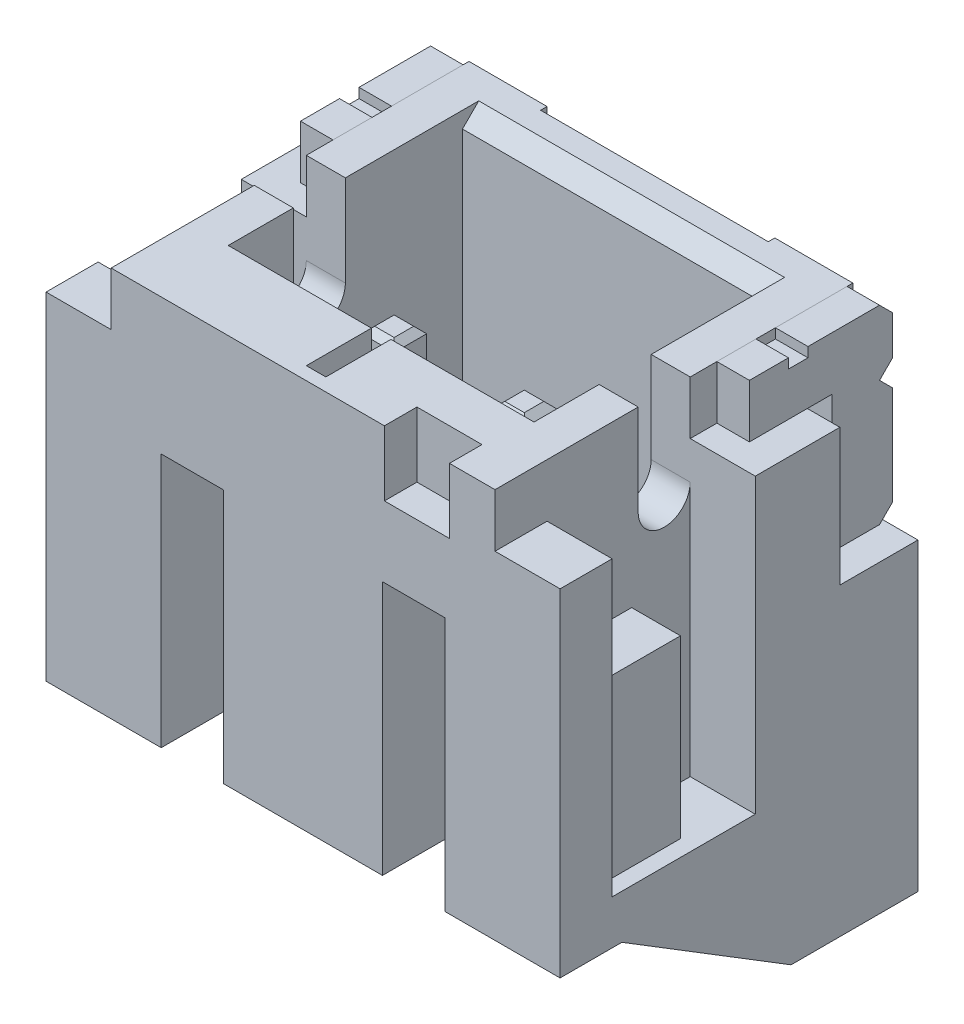
from build123d import *
from OCP.BRepFilletAPI import BRepFilletAPI_MakeChamfer

# Parameters (mm, degrees)
BODY1_W                               = 5.9
BODY1_H                               = 5.5
EXTRUDE_1_DEPTH                       = 6
SKETCH_2_W                            = 4.7
SKETCH_2_H                            = 3.6
CUT_EXTRUDE_1_DEPTH                   = 4.2
SKETCH_5_W                            = 0.7
SKETCH_5_H                            = 4.15
CUT_EXTRUDE_4_DEPTH                   = 0.4
SKETCH_8_W                            = 0.3
SKETCH_8_H                            = 4.2
CUT_EXTRUDE_6_DEPTH                   = 0.75
CUT_EXTRUDE_7_REACH                   = 12.053
SKETCH_10_W                           = 0.5
SKETCH_10_H                           = 1.6
EXTRUDE_2_DEPTH                       = 0.3
CHAMFER_2_SIZE                        = 0.25
SKETCH_18_W                           = 3.5
SKETCH_18_H                           = 6
CUT_EXTRUDE_8_DEPTH                   = 0.1
EXTRUDE_6_DEPTH                       = 1
SKETCH_20_W                           = 1.3
SKETCH_20_H                           = 2.7
EXTRUDE_7_DEPTH                       = 0.75
EXTRUDE_8_DEPTH                       = 0.5
CHAMFER_9_SIZE                        = 0.25
SWEEP_START                           = 1.7
SWEEP_1_DEPTH                         = 0.5
CHAMFER_8_SIZE                        = 0.1
SKETCH_22_W                           = 1.6
SKETCH_22_H                           = 3.25
EXTRUDE_9_DEPTH                       = 0.2
CHAMFER_10_SIZE                       = 0.072794047
CHAMFER_10_SIZE_2                     = 0.2
CHAMFER_11_SIZE2                      = 0.2
CHAMFER_11_SIZE                       = 0.549495484
PATTERN_LINEAR_5_COUNT                = 2
PATTERN_LINEAR_5_PITCH                = 2
CHAMFER_8_OF_PATTERN_LINEAR_5_SIZE    = 0.1
CHAMFER_10_OF_PATTERN_LINEAR_5_SIZE   = 0.072794047
CHAMFER_10_OF_PATTERN_LINEAR_5_SIZE_2 = 0.2
CHAMFER_11_OF_PATTERN_LINEAR_5_SIZE2  = 0.2
CHAMFER_11_OF_PATTERN_LINEAR_5_SIZE   = 0.549495484
SKETCH_4_W                            = 0.96
SKETCH_4_H                            = 3.91
CUT_EXTRUDE_3_DEPTH                   = 1.2
SKETCH_23_W                           = 1
SKETCH_23_H                           = 0.5
CUT_EXTRUDE_9_DEPTH                   = 1
SKETCH_24_R                           = 0.05
CUT_EXTRUDE_10_DEPTH                  = 0.1


# Read off the part's stored shape, not the designer's step: По траектории1
with BuildPart() as part:
    # Body1 → Бобышка-Вытянуть1 (new body)
    with BuildSketch(Plane(origin=(0, 0, 0), x_dir=(1, 0, 0), z_dir=(0, 1, 0))):
        with Locations((2.95, -2.75)):
            Rectangle(BODY1_W, BODY1_H)
    extrude(amount=EXTRUDE_1_DEPTH)

    # Эскиз2 → Вырез-Вытянуть1 (cut)
    with BuildSketch(Plane(origin=(0, 6, 0), x_dir=(1, 0, 0), z_dir=(0, 1, 0))):
        with Locations((2.95, -2.5)):
            Rectangle(SKETCH_2_W, SKETCH_2_H)
    extrude(amount=-CUT_EXTRUDE_1_DEPTH, mode=Mode.SUBTRACT)

    # Эскиз5 → Вырез-Вытянуть4 (cut)
    with BuildSketch(Plane(origin=(0, 0, 4.8), x_dir=(1, 0, 0), z_dir=(0, 1, 0))):
        with Locations((1.95, 2.725)):
            Rectangle(SKETCH_5_W, SKETCH_5_H)
    cut_extrude_4 = extrude(amount=CUT_EXTRUDE_4_DEPTH, mode=Mode.SUBTRACT)

    # Эскиз8 → Вырез-Вытянуть6 (cut)
    with BuildSketch(Plane.XY.offset(4.3)):
        with Locations((2.95, 3.9)):
            Rectangle(SKETCH_8_W, SKETCH_8_H)
    extrude(amount=CUT_EXTRUDE_6_DEPTH, mode=Mode.SUBTRACT)

    # Эскиз9 → Вырез-Вытянуть7 (cut, up to next)
    with BuildSketch(Plane.ZY, mode=Mode.PRIVATE) as cut_extrude_7_sk1:
        with BuildLine():
            Line((2.5, 6), (3.3, 6))
            Line((3.3, 6), (3.3, 4.6))
            ThreePointArc((3.3, 4.6), (2.9, 4.2), (2.5, 4.6))
            Line((2.5, 4.6), (2.5, 6))
        make_face()
    cut_extrude_7_tool1 = extrude(cut_extrude_7_sk1.sketch, amount=-CUT_EXTRUDE_7_REACH, mode=Mode.PRIVATE) & part.part
    cut_extrude_7 = cut_extrude_7_tool1.solids().sort_by_distance((0, 5.140595, 2.9))[0]
    add(cut_extrude_7, mode=Mode.SUBTRACT)

    # Зеркальное отражение1: Вырез-Вытянуть7 across plane
    add(cut_extrude_7.mirror(Plane(origin=(2.95, 0, 0), x_dir=(0, 0, 1), z_dir=(1, 0, 0))), mode=Mode.SUBTRACT)

    # Эскиз10 → Бобышка-Вытянуть2 (add)
    with BuildSketch(Plane.XY.offset(0.7)):
        with Locations((2.95, 2.6)):
            Rectangle(SKETCH_10_W, SKETCH_10_H)
    extrude(amount=EXTRUDE_2_DEPTH)

    # Фаска2
    chamfer_2_edges = [part.edges().sort_by_distance(p)[0] for p in [
        (2.95, 3.4, 1),
    ]]
    chamfer(chamfer_2_edges, length=CHAMFER_2_SIZE)

    # Эскиз18 → Вырез-Вытянуть8 (cut)
    with BuildSketch(Plane(origin=(0, 0, 0), x_dir=(-1, 0, 0), z_dir=(0, 0, -1))):
        with Locations((-2.95, 3)):
            Rectangle(SKETCH_18_W, SKETCH_18_H)
    extrude(amount=-CUT_EXTRUDE_8_DEPTH, mode=Mode.SUBTRACT)

    # Эскиз19 → Бобышка-Вытянуть6 (add)
    with BuildSketch(Plane.ZY):
        Polygon((5.5, 5.18), (4.7, 5.18), (4.7, 0.68), (2.5, 0.68), (2.5, 5.18), (1.2, 5.18), (1.2, 3.08), (0, 3.08), (0, 0), (0, -1.6), (1.95, -1.6), (4.55, 0), (5.5, 0), align=None)
    extrude_6 = extrude(amount=EXTRUDE_6_DEPTH)

    # Эскиз20 → Бобышка-Вытянуть7 (add)
    with BuildSketch(Plane.ZY):
        with Locations((4.05, 2.03)):
            Rectangle(SKETCH_20_W, SKETCH_20_H)
    extrude_7 = extrude(amount=EXTRUDE_7_DEPTH)

    # Зеркальное отражение4: Бобышка-Вытянуть6, Бобышка-Вытянуть7 across plane
    add(extrude_6.mirror(Plane(origin=(2.95, 0, 0), x_dir=(0, 0, 1), z_dir=(1, 0, 0))))
    add(extrude_7.mirror(Plane(origin=(2.95, 0, 0), x_dir=(0, 0, 1), z_dir=(1, 0, 0))))

    # Фаска9
    chamfer_9_edges = [part.edges().sort_by_distance(p)[0] for p in [
        (2.95, 6, 0.7),
        (2.95, 6, 5.05),
    ]]
    chamfer(chamfer_9_edges, length=CHAMFER_9_SIZE)

    # По траектории1 outline → По траектории1 (add)
    with BuildSketch(Plane.YZ.offset(SWEEP_START)):
        with BuildLine():
            add(Edge.make_bspline(
                [(1.8, 3.35), (2.1, 3.35), (2.4, 3.35), (3.466666667, 3.35), (4.233333333, 3.35), (5, 3.35)],
                knots=[0.550626024, 0.550626024, 0.550626024, 0.550626024, 0.677012455, 0.677012455, 1, 1, 1, 1], degree=3))
            Line((1.8, 3.35), (1.8, 2.85))
            add(Edge.make_bspline(
                [(1.8, 2.85), (2.1, 2.85), (2.4, 2.85), (3.466666667, 2.85), (4.233333333, 2.85), (5, 2.85)],
                knots=[0.550626024, 0.550626024, 0.550626024, 0.550626024, 0.677012455, 0.677012455, 1, 1, 1, 1], degree=3))
            Line((5, 2.85), (5, 3.35))
        make_face()
        with BuildLine():
            Line((-1.6662e-05, 0.942155021), (0, 2.45))
            add(Edge.make_bspline(
                [(0, 2.45), (0, 2.553716576), (0.042196888, 2.657882313), (0.154637487, 2.770322912), (0.199605417, 2.800099176), (0.296209882, 2.839814108), (0.331279974, 2.849979865), (0.4, 2.85)],
                knots=[0.210644051, 0.210644051, 0.210644051, 0.210644051, 0.28233448, 0.28233448, 0.318179695, 0.318179695, 0.354024909, 0.354024909, 0.354024909, 0.354024909], degree=3))
            Line((0.4, 2.85), (0.4, 3.35))
            add(Edge.make_bspline(
                [(-0.5, 2.45), (-0.5, 2.683362296), (-0.405057001, 2.917735205), (-0.152065654, 3.170726552), (-0.050887811, 3.237723146), (0.166472235, 3.327081743), (0.298557942, 3.349954697), (0.4, 3.35)],
                knots=[0.210644051, 0.210644051, 0.210644051, 0.210644051, 0.28233448, 0.28233448, 0.318179695, 0.318179695, 0.354024909, 0.354024909, 0.354024909, 0.354024909], degree=3))
            Line((-0.5, 2.45), (-0.500062578, 0.957586603))
            ThreePointArc((-0.500062578, 0.957586603), (-0.606740821, 0.699860892), (-0.84481038, 0.554514153))
            Line((-0.84481038, 0.554514153), (-2.621788936, 0.399048675))
            Line((-2.621788936, 0.399048675), (-2.578211064, -0.099048675))
            Line((-2.578211064, -0.099048675), (-0.77045154, 0.05910979))
            add(Edge.make_bspline(
                [(-0.77045154, 0.05910979), (-0.765813702, 0.060071241), (-0.761062531, 0.061056387), (-0.666053166, 0.08076061), (-0.554662574, 0.121818295), (-0.377229261, 0.226512766), (-0.297597323, 0.293038319), (-0.096380688, 0.525428514), (-0.013265113, 0.723592781), (-0.000458027, 0.934873745), (-0.000310905, 0.937300837), (-0.000163784, 0.939727929), (-1.6662e-05, 0.942155021)],
                knots=[-0.013536462, -0.013536462, -0.013536462, -0.013536462, 0, 0, 0.25, 0.25, 0.5, 0.5, 1, 1, 1, 1.005743755, 1.005743755, 1.005743755, 1.005743755], degree=3))
        make_face()
    sweep_1 = extrude(amount=SWEEP_1_DEPTH)

    # Фаска8
    chamfer_8_edges = [part.edges().sort_by_distance(p)[0] for p in [
        (1.95, 5, 2.85),
        (2.2, 5, 3.1),
        (1.95, 5, 3.35),
        (1.7, 5, 3.1),
        (1.95, -2.621788936, 0.399048675),
        (2.2, -2.6, 0.15),
        (1.95, -2.578211064, -0.099048675),
        (1.7, -2.6, 0.15),
    ]]
    chamfer(chamfer_8_edges, length=CHAMFER_8_SIZE)

    # Эскиз22 → Бобышка-Вытянуть9 (add)
    with BuildSketch(Plane(origin=(0, 1.8, 0), x_dir=(1, 0, 0), z_dir=(0, 1, 0))):
        with Locations((1.95, -3.425)):
            Rectangle(SKETCH_22_W, SKETCH_22_H)
    extrude_9 = extrude(amount=EXTRUDE_9_DEPTH)

    # Фаска10
    chamfer_10_edges_1 = [part.edges().sort_by_distance(p)[0] for p in [
        (1.15, 2, 3.05),
    ]]
    chamfer_10_side_1 = [part.faces().sort_by_distance(p)[0] for p in [
        (1.151455881, 2, 3.05),
    ]]
    chamfer_10_edges_2 = [part.edges().sort_by_distance(p)[0] for p in [
        (2.75, 2, 3.05),
    ]]
    chamfer_10_side_2 = [part.faces().sort_by_distance(p)[0] for p in [
        (2.748544119, 2, 3.05),
    ]]
    chamfer_10 = BRepFilletAPI_MakeChamfer(part.part.solid().wrapped)
    for e in chamfer_10_edges_1:
        chamfer_10.Add(CHAMFER_10_SIZE - 0.0001, CHAMFER_10_SIZE_2 - 0.0001, e.wrapped, chamfer_10_side_1[0].wrapped)
    for e in chamfer_10_edges_2:
        chamfer_10.Add(CHAMFER_10_SIZE - 0.0001, CHAMFER_10_SIZE_2 - 0.0001, e.wrapped, chamfer_10_side_2[0].wrapped)
    add(Compound.cast(chamfer_10.Shape()), mode=Mode.REPLACE)  # a hair under: the kernel refuses the full size

    # Фаска11
    chamfer_11_edges = [part.edges().sort_by_distance(p)[0] for p in [
        (1.95, 2, 1.8),
    ]]
    chamfer_11_side = [part.faces().sort_by_distance(p)[0] for p in [
        (1.95, 2, 1.804),
    ]]
    chamfer(chamfer_11_edges, length=CHAMFER_11_SIZE - 0.0001, length2=CHAMFER_11_SIZE2 - 0.0001, reference=chamfer_11_side[0])  # a hair under: the kernel refuses the full size

    # Линейный массив5: Вырез-Вытянуть4, По траектории1, Бобышка-Вытянуть9 ×2
    with Locations(*[(i * PATTERN_LINEAR_5_PITCH, 0, 0) for i in range(1, PATTERN_LINEAR_5_COUNT)]):
        add(cut_extrude_4, mode=Mode.SUBTRACT)
        add(sweep_1)
        add(extrude_9)

    # Фаска8 of Линейный массив5
    chamfer_8_of_pattern_linear_5_edges = [part.edges().sort_by_distance(p)[0] for p in [
        (3.95, 5, 2.85),
        (4.2, 5, 3.1),
        (3.95, 5, 3.35),
        (3.7, 5, 3.1),
        (3.95, -2.621788936, 0.399048675),
        (4.2, -2.6, 0.15),
        (3.95, -2.578211064, -0.099048675),
        (3.7, -2.6, 0.15),
    ]]
    chamfer(chamfer_8_of_pattern_linear_5_edges, length=CHAMFER_8_OF_PATTERN_LINEAR_5_SIZE)

    # Фаска10 of Линейный массив5
    chamfer_10_of_pattern_linear_5_edges_1 = [part.edges().sort_by_distance(p)[0] for p in [
        (3.15, 2, 3.05),
    ]]
    chamfer_10_of_pattern_linear_5_side_1 = [part.faces().sort_by_distance(p)[0] for p in [
        (3.151455881, 2, 3.05),
    ]]
    chamfer_10_of_pattern_linear_5_edges_2 = [part.edges().sort_by_distance(p)[0] for p in [
        (4.75, 2, 3.05),
    ]]
    chamfer_10_of_pattern_linear_5_side_2 = [part.faces().sort_by_distance(p)[0] for p in [
        (4.748544119, 2, 3.05),
    ]]
    chamfer_10_of_pattern_linear_5 = BRepFilletAPI_MakeChamfer(part.part.solid().wrapped)
    for e in chamfer_10_of_pattern_linear_5_edges_1:
        chamfer_10_of_pattern_linear_5.Add(CHAMFER_10_OF_PATTERN_LINEAR_5_SIZE - 0.0001, CHAMFER_10_OF_PATTERN_LINEAR_5_SIZE_2 - 0.0001, e.wrapped, chamfer_10_of_pattern_linear_5_side_1[0].wrapped)
    for e in chamfer_10_of_pattern_linear_5_edges_2:
        chamfer_10_of_pattern_linear_5.Add(CHAMFER_10_OF_PATTERN_LINEAR_5_SIZE - 0.0001, CHAMFER_10_OF_PATTERN_LINEAR_5_SIZE_2 - 0.0001, e.wrapped, chamfer_10_of_pattern_linear_5_side_2[0].wrapped)
    add(Compound.cast(chamfer_10_of_pattern_linear_5.Shape()), mode=Mode.REPLACE)  # a hair under: the kernel refuses the full size

    # Фаска11 of Линейный массив5
    chamfer_11_of_pattern_linear_5_edges = [part.edges().sort_by_distance(p)[0] for p in [
        (3.95, 2, 1.8),
    ]]
    chamfer_11_of_pattern_linear_5_side = [part.faces().sort_by_distance(p)[0] for p in [
        (3.95, 2, 1.804),
    ]]
    chamfer(chamfer_11_of_pattern_linear_5_edges, length=CHAMFER_11_OF_PATTERN_LINEAR_5_SIZE - 0.0001, length2=CHAMFER_11_OF_PATTERN_LINEAR_5_SIZE2 - 0.0001, reference=chamfer_11_of_pattern_linear_5_side[0])  # a hair under: the kernel refuses the full size

    # Эскиз4 → Вырез-Вытянуть3 (cut)
    with BuildSketch(Plane.XY.offset(5.5)):
        with Locations((1.25, 1.955)):
            Rectangle(SKETCH_4_W, SKETCH_4_H)
        with Locations((4.65, 1.955)):
            Rectangle(SKETCH_4_W, SKETCH_4_H)
    extrude(amount=-CUT_EXTRUDE_3_DEPTH, mode=Mode.SUBTRACT)

    # Эскиз23 → Вырез-Вытянуть9 (cut)
    with BuildSketch(Plane(origin=(0, 6, 0), x_dir=(1, 0, 0), z_dir=(0, 1, 0))):
        with Locations((4.7, -5.25)):
            Rectangle(SKETCH_23_W, SKETCH_23_H)
    extrude(amount=-CUT_EXTRUDE_9_DEPTH, mode=Mode.SUBTRACT)


with BuildPart() as body_2:
    # Эскиз21 → Бобышка-Вытянуть8 (new body)
    with BuildSketch(Plane.ZY):
        Polygon((2.09, 5.18), (2.09, 6), (1.49, 6), (1.49, 5.85), (1.19, 5.85), (1.19, 6), (0.09, 6), (-0.11, 5.8), (-0.11, 5.2), (0.09, 5), (-0.11, 4.8), (-0.11, 3.28), (0.09, 3.08), (0.823402773, 3.08), (0.823402773, 5.18), align=None)
    extrude(amount=EXTRUDE_8_DEPTH)


with BuildPart() as body_3:
    # Зеркальное отражение6: mirrored copy
    add(body_2.part.mirror(Plane(origin=(2.95, 0, 0), x_dir=(0, 0, 1), z_dir=(1, 0, 0))))


with BuildPart() as body_2_1:
    add(body_2.part)

    # Эскиз24 → Вырез-Вытянуть10 (cut)
    with BuildSketch(Plane(origin=(0, 0, -0.11), x_dir=(-1, 0, 0), z_dir=(0, 0, -1))):
        with Locations(Location((0.25, 4.54, 0), (0, 0, 90))):
            Circle(SKETCH_24_R)
    extrude(amount=-CUT_EXTRUDE_10_DEPTH, mode=Mode.SUBTRACT)


solid = Compound([part.part, body_3.part, body_2_1.part])
